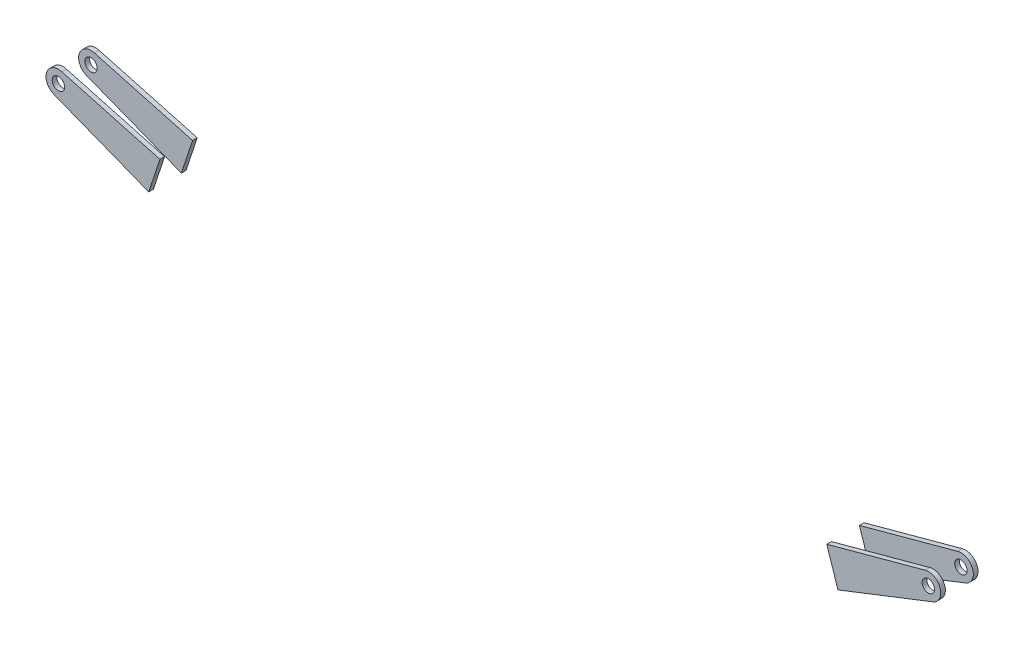
from build123d import *

# Parameters (mm, degrees)
BOSS_EXTRUDE1_START     = 280
BOSS_EXTRUDE1_OUTLINE_R = 4
BOSS_EXTRUDE1_DEPTH     = 3


# Read off the part's stored shape, not the designer's step: Boss-Extrude1
with BuildPart() as part:
    # Boss-Extrude1 outline → Boss-Extrude1 (new body)
    with BuildSketch(Plane.XY.offset(BOSS_EXTRUDE1_START)):
        with BuildLine():
            Line((221.855223646, -2261.318170185), (282.912569681, -2237.450968921))
            ThreePointArc((282.912569681, -2237.450968921), (287.596282146, -2227.490717719), (277.901209765, -2222.280215058))
            Line((277.901209765, -2222.280215058), (214.64103709, -2239.478859016))
            Line((214.64103709, -2239.478859016), (221.855223646, -2261.318170185))
        make_face()
        with Locations((280, -2230)):
            Circle(BOSS_EXTRUDE1_OUTLINE_R, mode=Mode.SUBTRACT)
    extrude(amount=BOSS_EXTRUDE1_DEPTH)


with BuildPart() as body_2:
    # Mirror1: mirrored copy
    add(part.part.mirror(Plane(origin=(0, 0, 271), x_dir=(1, 0, 0), z_dir=(0, 0, -1))))


with BuildPart() as body_3:
    # Mirror2: mirrored copy
    add(part.part.mirror(Plane(origin=(0, 0, 0), x_dir=(0, 0, 1), z_dir=(1, 0, 0))))


with BuildPart() as body_4:
    # Mirror2 2: mirrored copy
    add(body_2.part.mirror(Plane(origin=(0, 0, 0), x_dir=(0, 0, 1), z_dir=(1, 0, 0))))


solid = Compound([part.part, body_2.part, body_3.part, body_4.part])
